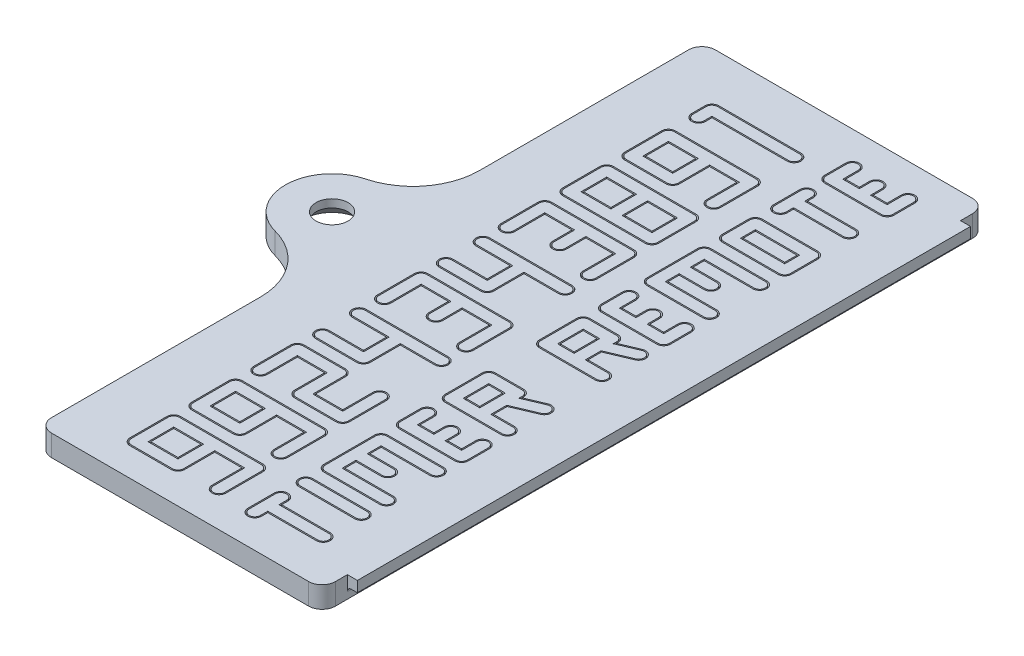
from build123d import *

# Parameters (mm, degrees)
DOOR_PLATE_1_6_SCREW_EAR_R5_R3_5_DEPTH        = 1.6
HOOK_FLANGE_0_75_X_0_8_INNER_FACE_P_2_W       = 0.9
HOOK_FLANGE_0_75_X_0_8_INNER_FACE_P_2_H       = 46
HOOK_FLANGE_0_75_X_0_8_INNER_FACE_PLANE_DEPTH = 0.8
SCREW_HOLE_2_4_FREE_SKETCH_R                  = 1.2
SCREW_HOLE_2_4_FREE_DEPTH                     = 73.114700304
SCREW_CSK_90DEG_M2_SIZE                       = 1
DOOR_CORNERS_R1_PRINT_R                       = 1
HOOK_FLANGE_ROOT_FILLET_R0_3_R                = 0.3
DOOR_TEXT_SLITS_9924343891_TIMER_REMOT_DEPTH  = 0.4
DOOR_TEXT_COUNTER_SLITS_SKETCH_W              = 2.24
DOOR_TEXT_COUNTER_SLITS_SKETCH_H              = 1.92
DOOR_TEXT_COUNTER_SLITS_SKETCH_W_2            = 2.04
DOOR_TEXT_COUNTER_SLITS_SKETCH_H_2            = 1.72
DOOR_TEXT_COUNTER_SLITS_SKETCH_W_3            = 1.24
DOOR_TEXT_COUNTER_SLITS_SKETCH_W_4            = 1.04
DOOR_TEXT_COUNTER_SLITS_SKETCH_W_5            = 3.32
DOOR_TEXT_COUNTER_SLITS_SKETCH_H_3            = 1.12
DOOR_TEXT_COUNTER_SLITS_SKETCH_W_6            = 3.12
DOOR_TEXT_COUNTER_SLITS_SKETCH_H_4            = 0.92
DOOR_TEXT_COUNTER_SLITS_DEPTH                 = 0.4


with BuildPart() as part:
    # Door Plate 1.6 + screw ear (R5 / R3.5) Sketch → Door Plate 1.6 + screw ear (R5 / R3.5) (new body)
    with BuildSketch(Plane(origin=(0, 0, 0), x_dir=(1, 0, 0), z_dir=(0, 1, 0))):
        with BuildLine():
            Line((9.35, 15.1), (30.65, 15.1))
            Line((30.65, 15.1), (30.65, 64.9))
            Line((30.65, 64.9), (9.35, 64.9))
            Line((9.35, 64.9), (9.35, 48.223594105))
            ThreePointArc((9.35, 48.223594105), (8.307494751, 45.167741475), (5.614705882, 43.386185808))
            ThreePointArc((5.614705882, 43.386185808), (3, 40), (5.614705882, 36.613814192))
            ThreePointArc((5.614705882, 36.613814192), (8.307494751, 34.832258525), (9.35, 31.776405895))
            Line((9.35, 31.776405895), (9.35, 15.1))
        make_face()
    extrude(amount=DOOR_PLATE_1_6_SCREW_EAR_R5_R3_5_DEPTH)

    # Hook Flange 0.75 x 0.8 _inner-face p 2 → Hook Flange 0.75 x 0.8 _inner-face plane (add)
    with BuildSketch(Plane(origin=(0, 0.8, 0), x_dir=(1, 0, 0), z_dir=(0, 1, 0))):
        with Locations((30.95, 40)):
            Rectangle(HOOK_FLANGE_0_75_X_0_8_INNER_FACE_P_2_W, HOOK_FLANGE_0_75_X_0_8_INNER_FACE_P_2_H)
    extrude(amount=HOOK_FLANGE_0_75_X_0_8_INNER_FACE_PLANE_DEPTH)

    # Screw Hole 2.4 (free) Sketch → Screw Hole 2.4 (free) (cut, through all)
    with BuildSketch(Plane(origin=(0, 0, 0), x_dir=(1, 0, 0), z_dir=(0, 1, 0))):
        with Locations((6.5, 40)):
            Circle(SCREW_HOLE_2_4_FREE_SKETCH_R)
    extrude(amount=SCREW_HOLE_2_4_FREE_DEPTH, mode=Mode.SUBTRACT)

    # Screw CSK 90deg (M2)
    screw_csk_90deg_m2_edges = [part.edges().sort_by_distance(p)[0] for p in [
        (5.3, 0, -40),
    ]]
    chamfer(screw_csk_90deg_m2_edges, length=SCREW_CSK_90DEG_M2_SIZE)

    # Door Corners R1 (print)
    door_corners_r1_print_edges = [part.edges().sort_by_distance(p)[0] for p in [
        (9.35, 0.8, -64.9),
        (30.65, 0.8, -64.9),
        (30.65, 0.8, -15.1),
        (9.35, 0.8, -15.1),
    ]]
    fillet(door_corners_r1_print_edges, radius=DOOR_CORNERS_R1_PRINT_R)

    # Hook Flange Root Fillet R0.3
    hook_flange_root_fillet_r0_3_edges = [part.edges().sort_by_distance(p)[0] for p in [
        (30.65, 0.8, -40),
    ]]
    fillet(hook_flange_root_fillet_r0_3_edges, radius=HOOK_FLANGE_ROOT_FILLET_R0_3_R)

    # Door Text Slits 9924343891 _ TIMER R 2 → Door Text Slits 9924343891 _ TIMER REMOT (cut)
    # profile 1 of 21: a face of its own
    with BuildSketch(Plane(origin=(0, 1.6, 0), x_dir=(1, 0, 0), z_dir=(0, 1, 0))):
        with BuildLine():
            Line((17.2, 17.22), (14.12, 17.22))
            ThreePointArc((14.12, 17.22), (13.752304474, 17.372304474), (13.6, 17.74))
            Line((13.6, 17.74), (13.6, 20.5))
            ThreePointArc((13.6, 20.5), (13.752304474, 20.867695526), (14.12, 21.02))
            Line((14.12, 21.02), (20.28, 21.02))
            ThreePointArc((20.28, 21.02), (20.647695526, 20.867695526), (20.8, 20.5))
            Line((20.8, 20.5), (20.8, 17.74))
            ThreePointArc((20.8, 17.74), (20.28, 17.22), (19.76, 17.74))
            Line((19.76, 17.74), (19.76, 19.98))
            Line((19.76, 19.98), (17.72, 19.98))
            Line((17.72, 19.98), (17.72, 17.74))
            ThreePointArc((17.72, 17.74), (17.567695526, 17.372304474), (17.2, 17.22))
        make_face()
        with BuildLine():
            Line((13.7, 20.5), (13.7, 17.74))
            ThreePointArc((13.7, 17.74), (13.823015152, 17.443015152), (14.12, 17.32))
            Line((14.12, 17.32), (17.2, 17.32))
            ThreePointArc((17.2, 17.32), (17.496984848, 17.443015152), (17.62, 17.74))
            Line((17.62, 17.74), (17.62, 20.08))
            Line((17.62, 20.08), (19.86, 20.08))
            Line((19.86, 20.08), (19.86, 17.74))
            ThreePointArc((19.86, 17.74), (20.28, 17.32), (20.7, 17.74))
            Line((20.7, 17.74), (20.7, 20.5))
            ThreePointArc((20.7, 20.5), (20.576984848, 20.796984848), (20.28, 20.92))
            Line((20.28, 20.92), (14.12, 20.92))
            ThreePointArc((14.12, 20.92), (13.823015152, 20.796984848), (13.7, 20.5))
        make_face(mode=Mode.SUBTRACT)
    # profile 2 of 21: a face of its own
    with BuildSketch(Plane(origin=(0, 1.6, 0), x_dir=(1, 0, 0), z_dir=(0, 1, 0))):
        with BuildLine():
            Line((17.2, 21.86), (14.12, 21.86))
            ThreePointArc((14.12, 21.86), (13.752304474, 22.012304474), (13.6, 22.38))
            Line((13.6, 22.38), (13.6, 25.14))
            ThreePointArc((13.6, 25.14), (13.752304474, 25.507695526), (14.12, 25.66))
            Line((14.12, 25.66), (20.28, 25.66))
            ThreePointArc((20.28, 25.66), (20.647695526, 25.507695526), (20.8, 25.14))
            Line((20.8, 25.14), (20.8, 22.38))
            ThreePointArc((20.8, 22.38), (20.28, 21.86), (19.76, 22.38))
            Line((19.76, 22.38), (19.76, 24.62))
            Line((19.76, 24.62), (17.72, 24.62))
            Line((17.72, 24.62), (17.72, 22.38))
            ThreePointArc((17.72, 22.38), (17.567695526, 22.012304474), (17.2, 21.86))
        make_face()
        with BuildLine():
            Line((13.7, 25.14), (13.7, 22.38))
            ThreePointArc((13.7, 22.38), (13.823015152, 22.083015152), (14.12, 21.96))
            Line((14.12, 21.96), (17.2, 21.96))
            ThreePointArc((17.2, 21.96), (17.496984848, 22.083015152), (17.62, 22.38))
            Line((17.62, 22.38), (17.62, 24.72))
            Line((17.62, 24.72), (19.86, 24.72))
            Line((19.86, 24.72), (19.86, 22.38))
            ThreePointArc((19.86, 22.38), (20.28, 21.96), (20.7, 22.38))
            Line((20.7, 22.38), (20.7, 25.14))
            ThreePointArc((20.7, 25.14), (20.576984848, 25.436984848), (20.28, 25.56))
            Line((20.28, 25.56), (14.12, 25.56))
            ThreePointArc((14.12, 25.56), (13.823015152, 25.436984848), (13.7, 25.14))
        make_face(mode=Mode.SUBTRACT)
    # profile 3 of 21: a face of its own
    with BuildSketch(Plane(origin=(0, 1.6, 0), x_dir=(1, 0, 0), z_dir=(0, 1, 0))):
        with BuildLine():
            Line((20.8, 29.78), (20.8, 27.02))
            ThreePointArc((20.8, 27.02), (20.647695526, 26.652304474), (20.28, 26.5))
            Line((20.28, 26.5), (17.2, 26.5))
            ThreePointArc((17.2, 26.5), (16.832304474, 26.652304474), (16.68, 27.02))
            Line((16.68, 27.02), (16.68, 29.26))
            Line((16.68, 29.26), (14.64, 29.26))
            Line((14.64, 29.26), (14.64, 27.02))
            ThreePointArc((14.64, 27.02), (14.12, 26.5), (13.6, 27.02))
            Line((13.6, 27.02), (13.6, 29.78))
            ThreePointArc((13.6, 29.78), (13.752304474, 30.147695526), (14.12, 30.3))
            Line((14.12, 30.3), (17.2, 30.3))
            ThreePointArc((17.2, 30.3), (17.567695526, 30.147695526), (17.72, 29.78))
            Line((17.72, 29.78), (17.72, 27.54))
            Line((17.72, 27.54), (19.76, 27.54))
            Line((19.76, 27.54), (19.76, 29.78))
            ThreePointArc((19.76, 29.78), (20.28, 30.3), (20.8, 29.78))
        make_face()
        with BuildLine():
            Line((14.54, 29.36), (14.54, 27.02))
            ThreePointArc((14.54, 27.02), (14.12, 26.6), (13.7, 27.02))
            Line((13.7, 27.02), (13.7, 29.78))
            ThreePointArc((13.7, 29.78), (13.823015152, 30.076984848), (14.12, 30.2))
            Line((14.12, 30.2), (17.2, 30.2))
            ThreePointArc((17.2, 30.2), (17.496984848, 30.076984848), (17.62, 29.78))
            Line((17.62, 29.78), (17.62, 27.44))
            Line((17.62, 27.44), (19.86, 27.44))
            Line((19.86, 27.44), (19.86, 29.78))
            ThreePointArc((19.86, 29.78), (20.28, 30.2), (20.7, 29.78))
            Line((20.7, 29.78), (20.7, 27.02))
            ThreePointArc((20.7, 27.02), (20.576984848, 26.723015152), (20.28, 26.6))
            Line((20.28, 26.6), (17.2, 26.6))
            ThreePointArc((17.2, 26.6), (16.903015152, 26.723015152), (16.78, 27.02))
            Line((16.78, 27.02), (16.78, 29.36))
            Line((16.78, 29.36), (14.54, 29.36))
        make_face(mode=Mode.SUBTRACT)
    # profile 4 of 21: a face of its own
    with BuildSketch(Plane(origin=(0, 1.6, 0), x_dir=(1, 0, 0), z_dir=(0, 1, 0))):
        with BuildLine():
            Line((20.28, 33.9), (17.72, 33.9))
            Line((17.72, 33.9), (17.72, 31.66))
            ThreePointArc((17.72, 31.66), (17.567695526, 31.292304474), (17.2, 31.14))
            Line((17.2, 31.14), (14.12, 31.14))
            ThreePointArc((14.12, 31.14), (13.6, 31.66), (14.12, 32.18))
            Line((14.12, 32.18), (16.68, 32.18))
            Line((16.68, 32.18), (16.68, 33.9))
            Line((16.68, 33.9), (14.12, 33.9))
            ThreePointArc((14.12, 33.9), (13.6, 34.42), (14.12, 34.94))
            Line((14.12, 34.94), (20.28, 34.94))
            ThreePointArc((20.28, 34.94), (20.647695526, 34.787695526), (20.8, 34.42))
            ThreePointArc((20.8, 34.42), (20.647695526, 34.052304474), (20.28, 33.9))
        make_face()
        with BuildLine():
            Line((17.62, 31.66), (17.62, 34))
            Line((17.62, 34), (20.28, 34))
            ThreePointArc((20.28, 34), (20.576984848, 34.123015152), (20.7, 34.42))
            ThreePointArc((20.7, 34.42), (20.576984848, 34.716984848), (20.28, 34.84))
            Line((20.28, 34.84), (14.12, 34.84))
            ThreePointArc((14.12, 34.84), (13.7, 34.42), (14.12, 34))
            Line((14.12, 34), (16.78, 34))
            Line((16.78, 34), (16.78, 32.08))
            Line((16.78, 32.08), (14.12, 32.08))
            ThreePointArc((14.12, 32.08), (13.7, 31.66), (14.12, 31.24))
            Line((14.12, 31.24), (17.2, 31.24))
            ThreePointArc((17.2, 31.24), (17.496984848, 31.363015152), (17.62, 31.66))
        make_face(mode=Mode.SUBTRACT)
    # profile 5 of 21: a face of its own
    with BuildSketch(Plane(origin=(0, 1.6, 0), x_dir=(1, 0, 0), z_dir=(0, 1, 0))):
        with BuildLine():
            Line((19.76, 36.3), (19.76, 38.54))
            Line((19.76, 38.54), (17.72, 38.54))
            Line((17.72, 38.54), (17.72, 37.1))
            ThreePointArc((17.72, 37.1), (17.2, 36.58), (16.68, 37.1))
            Line((16.68, 37.1), (16.68, 38.54))
            Line((16.68, 38.54), (14.64, 38.54))
            Line((14.64, 38.54), (14.64, 36.3))
            ThreePointArc((14.64, 36.3), (14.12, 35.78), (13.6, 36.3))
            Line((13.6, 36.3), (13.6, 39.06))
            ThreePointArc((13.6, 39.06), (13.752304474, 39.427695526), (14.12, 39.58))
            Line((14.12, 39.58), (20.28, 39.58))
            ThreePointArc((20.28, 39.58), (20.647695526, 39.427695526), (20.8, 39.06))
            Line((20.8, 39.06), (20.8, 36.3))
            ThreePointArc((20.8, 36.3), (20.28, 35.78), (19.76, 36.3))
        make_face()
        with BuildLine():
            Line((13.7, 36.3), (13.7, 39.06))
            ThreePointArc((13.7, 39.06), (13.823015152, 39.356984848), (14.12, 39.48))
            Line((14.12, 39.48), (20.28, 39.48))
            ThreePointArc((20.28, 39.48), (20.576984848, 39.356984848), (20.7, 39.06))
            Line((20.7, 39.06), (20.7, 36.3))
            ThreePointArc((20.7, 36.3), (20.28, 35.88), (19.86, 36.3))
            Line((19.86, 36.3), (19.86, 38.64))
            Line((19.86, 38.64), (17.62, 38.64))
            Line((17.62, 38.64), (17.62, 37.1))
            ThreePointArc((17.62, 37.1), (17.2, 36.68), (16.78, 37.1))
            Line((16.78, 37.1), (16.78, 38.64))
            Line((16.78, 38.64), (14.54, 38.64))
            Line((14.54, 38.64), (14.54, 36.3))
            ThreePointArc((14.54, 36.3), (14.12, 35.88), (13.7, 36.3))
        make_face(mode=Mode.SUBTRACT)
    # profile 6 of 21: a face of its own
    with BuildSketch(Plane(origin=(0, 1.6, 0), x_dir=(1, 0, 0), z_dir=(0, 1, 0))):
        with BuildLine():
            Line((20.28, 43.18), (17.72, 43.18))
            Line((17.72, 43.18), (17.72, 40.94))
            ThreePointArc((17.72, 40.94), (17.567695526, 40.572304474), (17.2, 40.42))
            Line((17.2, 40.42), (14.12, 40.42))
            ThreePointArc((14.12, 40.42), (13.6, 40.94), (14.12, 41.46))
            Line((14.12, 41.46), (16.68, 41.46))
            Line((16.68, 41.46), (16.68, 43.18))
            Line((16.68, 43.18), (14.12, 43.18))
            ThreePointArc((14.12, 43.18), (13.6, 43.7), (14.12, 44.22))
            Line((14.12, 44.22), (20.28, 44.22))
            ThreePointArc((20.28, 44.22), (20.647695526, 44.067695526), (20.8, 43.7))
            ThreePointArc((20.8, 43.7), (20.647695526, 43.332304474), (20.28, 43.18))
        make_face()
        with BuildLine():
            Line((17.62, 40.94), (17.62, 43.28))
            Line((17.62, 43.28), (20.28, 43.28))
            ThreePointArc((20.28, 43.28), (20.576984848, 43.403015152), (20.7, 43.7))
            ThreePointArc((20.7, 43.7), (20.576984848, 43.996984848), (20.28, 44.12))
            Line((20.28, 44.12), (14.12, 44.12))
            ThreePointArc((14.12, 44.12), (13.7, 43.7), (14.12, 43.28))
            Line((14.12, 43.28), (16.78, 43.28))
            Line((16.78, 43.28), (16.78, 41.36))
            Line((16.78, 41.36), (14.12, 41.36))
            ThreePointArc((14.12, 41.36), (13.7, 40.94), (14.12, 40.52))
            Line((14.12, 40.52), (17.2, 40.52))
            ThreePointArc((17.2, 40.52), (17.496984848, 40.643015152), (17.62, 40.94))
        make_face(mode=Mode.SUBTRACT)
    # profile 7 of 21: a face of its own
    with BuildSketch(Plane(origin=(0, 1.6, 0), x_dir=(1, 0, 0), z_dir=(0, 1, 0))):
        with BuildLine():
            Line((19.76, 45.58), (19.76, 47.82))
            Line((19.76, 47.82), (17.72, 47.82))
            Line((17.72, 47.82), (17.72, 46.38))
            ThreePointArc((17.72, 46.38), (17.2, 45.86), (16.68, 46.38))
            Line((16.68, 46.38), (16.68, 47.82))
            Line((16.68, 47.82), (14.64, 47.82))
            Line((14.64, 47.82), (14.64, 45.58))
            ThreePointArc((14.64, 45.58), (14.12, 45.06), (13.6, 45.58))
            Line((13.6, 45.58), (13.6, 48.34))
            ThreePointArc((13.6, 48.34), (13.752304474, 48.707695526), (14.12, 48.86))
            Line((14.12, 48.86), (20.28, 48.86))
            ThreePointArc((20.28, 48.86), (20.647695526, 48.707695526), (20.8, 48.34))
            Line((20.8, 48.34), (20.8, 45.58))
            ThreePointArc((20.8, 45.58), (20.28, 45.06), (19.76, 45.58))
        make_face()
        with BuildLine():
            Line((13.7, 45.58), (13.7, 48.34))
            ThreePointArc((13.7, 48.34), (13.823015152, 48.636984848), (14.12, 48.76))
            Line((14.12, 48.76), (20.28, 48.76))
            ThreePointArc((20.28, 48.76), (20.576984848, 48.636984848), (20.7, 48.34))
            Line((20.7, 48.34), (20.7, 45.58))
            ThreePointArc((20.7, 45.58), (20.28, 45.16), (19.86, 45.58))
            Line((19.86, 45.58), (19.86, 47.92))
            Line((19.86, 47.92), (17.62, 47.92))
            Line((17.62, 47.92), (17.62, 46.38))
            ThreePointArc((17.62, 46.38), (17.2, 45.96), (16.78, 46.38))
            Line((16.78, 46.38), (16.78, 47.92))
            Line((16.78, 47.92), (14.54, 47.92))
            Line((14.54, 47.92), (14.54, 45.58))
            ThreePointArc((14.54, 45.58), (14.12, 45.16), (13.7, 45.58))
        make_face(mode=Mode.SUBTRACT)
    # profile 8 of 21: a face of its own
    with BuildSketch(Plane(origin=(0, 1.6, 0), x_dir=(1, 0, 0), z_dir=(0, 1, 0))):
        with BuildLine():
            Line((20.8, 52.98), (20.8, 50.22))
            ThreePointArc((20.8, 50.22), (20.647695526, 49.852304474), (20.28, 49.7))
            Line((20.28, 49.7), (14.12, 49.7))
            ThreePointArc((14.12, 49.7), (13.752304474, 49.852304474), (13.6, 50.22))
            Line((13.6, 50.22), (13.6, 52.98))
            ThreePointArc((13.6, 52.98), (13.752304474, 53.347695526), (14.12, 53.5))
            Line((14.12, 53.5), (20.28, 53.5))
            ThreePointArc((20.28, 53.5), (20.647695526, 53.347695526), (20.8, 52.98))
        make_face()
        with BuildLine():
            Line((20.7, 50.22), (20.7, 52.98))
            ThreePointArc((20.7, 52.98), (20.576984848, 53.276984848), (20.28, 53.4))
            Line((20.28, 53.4), (14.12, 53.4))
            ThreePointArc((14.12, 53.4), (13.823015152, 53.276984848), (13.7, 52.98))
            Line((13.7, 52.98), (13.7, 50.22))
            ThreePointArc((13.7, 50.22), (13.823015152, 49.923015152), (14.12, 49.8))
            Line((14.12, 49.8), (20.28, 49.8))
            ThreePointArc((20.28, 49.8), (20.576984848, 49.923015152), (20.7, 50.22))
        make_face(mode=Mode.SUBTRACT)
    # profile 9 of 21: a face of its own
    with BuildSketch(Plane(origin=(0, 1.6, 0), x_dir=(1, 0, 0), z_dir=(0, 1, 0))):
        with BuildLine():
            Line((17.2, 54.34), (14.12, 54.34))
            ThreePointArc((14.12, 54.34), (13.752304474, 54.492304474), (13.6, 54.86))
            Line((13.6, 54.86), (13.6, 57.62))
            ThreePointArc((13.6, 57.62), (13.752304474, 57.987695526), (14.12, 58.14))
            Line((14.12, 58.14), (20.28, 58.14))
            ThreePointArc((20.28, 58.14), (20.647695526, 57.987695526), (20.8, 57.62))
            Line((20.8, 57.62), (20.8, 54.86))
            ThreePointArc((20.8, 54.86), (20.28, 54.34), (19.76, 54.86))
            Line((19.76, 54.86), (19.76, 57.1))
            Line((19.76, 57.1), (17.72, 57.1))
            Line((17.72, 57.1), (17.72, 54.86))
            ThreePointArc((17.72, 54.86), (17.567695526, 54.492304474), (17.2, 54.34))
        make_face()
        with BuildLine():
            Line((13.7, 57.62), (13.7, 54.86))
            ThreePointArc((13.7, 54.86), (13.823015152, 54.563015152), (14.12, 54.44))
            Line((14.12, 54.44), (17.2, 54.44))
            ThreePointArc((17.2, 54.44), (17.496984848, 54.563015152), (17.62, 54.86))
            Line((17.62, 54.86), (17.62, 57.2))
            Line((17.62, 57.2), (19.86, 57.2))
            Line((19.86, 57.2), (19.86, 54.86))
            ThreePointArc((19.86, 54.86), (20.28, 54.44), (20.7, 54.86))
            Line((20.7, 54.86), (20.7, 57.62))
            ThreePointArc((20.7, 57.62), (20.576984848, 57.916984848), (20.28, 58.04))
            Line((20.28, 58.04), (14.12, 58.04))
            ThreePointArc((14.12, 58.04), (13.823015152, 57.916984848), (13.7, 57.62))
        make_face(mode=Mode.SUBTRACT)
    # profile 10 of 21: a face of its own
    with BuildSketch(Plane(origin=(0, 1.6, 0), x_dir=(1, 0, 0), z_dir=(0, 1, 0))):
        with BuildLine():
            Line((20.28, 60.36), (14.64, 60.36))
            Line((14.64, 60.36), (14.64, 59.88))
            ThreePointArc((14.64, 59.88), (14.12, 59.36), (13.6, 59.88))
            Line((13.6, 59.88), (13.6, 60.88))
            ThreePointArc((13.6, 60.88), (13.752304474, 61.247695526), (14.12, 61.4))
            Line((14.12, 61.4), (20.28, 61.4))
            ThreePointArc((20.28, 61.4), (20.647695526, 61.247695526), (20.8, 60.88))
            ThreePointArc((20.8, 60.88), (20.647695526, 60.512304474), (20.28, 60.36))
        make_face()
        with BuildLine():
            Line((14.54, 60.46), (14.54, 59.88))
            ThreePointArc((14.54, 59.88), (14.12, 59.46), (13.7, 59.88))
            Line((13.7, 59.88), (13.7, 60.88))
            ThreePointArc((13.7, 60.88), (13.823015152, 61.176984848), (14.12, 61.3))
            Line((14.12, 61.3), (20.28, 61.3))
            ThreePointArc((20.28, 61.3), (20.576984848, 61.176984848), (20.7, 60.88))
            ThreePointArc((20.7, 60.88), (20.576984848, 60.583015152), (20.28, 60.46))
            Line((20.28, 60.46), (14.54, 60.46))
        make_face(mode=Mode.SUBTRACT)
    # profile 11 of 21: a face of its own
    with BuildSketch(Plane(origin=(0, 1.6, 0), x_dir=(1, 0, 0), z_dir=(0, 1, 0))):
        with BuildLine():
            Line((23.64, 19.08), (27.28, 19.08))
            ThreePointArc((27.28, 19.08), (27.647695526, 18.927695526), (27.8, 18.56))
            ThreePointArc((27.8, 18.56), (27.647695526, 18.192304474), (27.28, 18.04))
            Line((27.28, 18.04), (23.64, 18.04))
            Line((23.64, 18.04), (23.64, 17.58))
            ThreePointArc((23.64, 17.58), (23.12, 17.06), (22.6, 17.58))
            Line((22.6, 17.58), (22.6, 19.54))
            ThreePointArc((22.6, 19.54), (23.12, 20.06), (23.64, 19.54))
            Line((23.64, 19.54), (23.64, 19.08))
        make_face()
        with BuildLine():
            Line((22.7, 17.58), (22.7, 19.54))
            ThreePointArc((22.7, 19.54), (23.12, 19.96), (23.54, 19.54))
            Line((23.54, 19.54), (23.54, 18.98))
            Line((23.54, 18.98), (27.28, 18.98))
            ThreePointArc((27.28, 18.98), (27.576984848, 18.856984848), (27.7, 18.56))
            ThreePointArc((27.7, 18.56), (27.576984848, 18.263015152), (27.28, 18.14))
            Line((27.28, 18.14), (23.54, 18.14))
            Line((23.54, 18.14), (23.54, 17.58))
            ThreePointArc((23.54, 17.58), (23.12, 17.16), (22.7, 17.58))
        make_face(mode=Mode.SUBTRACT)
    # profile 12 of 21: a face of its own
    with BuildSketch(Plane(origin=(0, 1.6, 0), x_dir=(1, 0, 0), z_dir=(0, 1, 0))):
        with BuildLine():
            Line((27.28, 20.9), (23.12, 20.9))
            ThreePointArc((23.12, 20.9), (22.6, 21.42), (23.12, 21.94))
            Line((23.12, 21.94), (27.28, 21.94))
            ThreePointArc((27.28, 21.94), (27.647695526, 21.787695526), (27.8, 21.42))
            ThreePointArc((27.8, 21.42), (27.647695526, 21.052304474), (27.28, 20.9))
        make_face()
        with BuildLine():
            Line((27.28, 21), (23.12, 21))
            ThreePointArc((23.12, 21), (22.7, 21.42), (23.12, 21.84))
            Line((23.12, 21.84), (27.28, 21.84))
            ThreePointArc((27.28, 21.84), (27.576984848, 21.716984848), (27.7, 21.42))
            ThreePointArc((27.7, 21.42), (27.576984848, 21.123015152), (27.28, 21))
        make_face(mode=Mode.SUBTRACT)
    # profile 13 of 21: a face of its own
    with BuildSketch(Plane(origin=(0, 1.6, 0), x_dir=(1, 0, 0), z_dir=(0, 1, 0))):
        with BuildLine():
            Line((27.28, 26.54), (23.64, 26.54))
            Line((23.64, 26.54), (23.64, 25.7))
            Line((23.64, 25.7), (25.5, 25.7))
            ThreePointArc((25.5, 25.7), (25.867695526, 25.547695526), (26.02, 25.18))
            ThreePointArc((26.02, 25.18), (25.867695526, 24.812304474), (25.5, 24.66))
            Line((25.5, 24.66), (23.64, 24.66))
            Line((23.64, 24.66), (23.64, 23.82))
            Line((23.64, 23.82), (27.28, 23.82))
            ThreePointArc((27.28, 23.82), (27.647695526, 23.667695526), (27.8, 23.3))
            ThreePointArc((27.8, 23.3), (27.647695526, 22.932304474), (27.28, 22.78))
            Line((27.28, 22.78), (23.12, 22.78))
            ThreePointArc((23.12, 22.78), (22.752304474, 22.932304474), (22.6, 23.3))
            Line((22.6, 23.3), (22.6, 27.06))
            ThreePointArc((22.6, 27.06), (22.752304474, 27.427695526), (23.12, 27.58))
            Line((23.12, 27.58), (27.28, 27.58))
            ThreePointArc((27.28, 27.58), (27.647695526, 27.427695526), (27.8, 27.06))
            ThreePointArc((27.8, 27.06), (27.647695526, 26.692304474), (27.28, 26.54))
        make_face()
        with BuildLine():
            Line((27.28, 22.88), (23.12, 22.88))
            ThreePointArc((23.12, 22.88), (22.823015152, 23.003015152), (22.7, 23.3))
            Line((22.7, 23.3), (22.7, 27.06))
            ThreePointArc((22.7, 27.06), (22.823015152, 27.356984848), (23.12, 27.48))
            Line((23.12, 27.48), (27.28, 27.48))
            ThreePointArc((27.28, 27.48), (27.576984848, 27.356984848), (27.7, 27.06))
            ThreePointArc((27.7, 27.06), (27.576984848, 26.763015152), (27.28, 26.64))
            Line((27.28, 26.64), (23.54, 26.64))
            Line((23.54, 26.64), (23.54, 25.6))
            Line((23.54, 25.6), (25.5, 25.6))
            ThreePointArc((25.5, 25.6), (25.796984848, 25.476984848), (25.92, 25.18))
            ThreePointArc((25.92, 25.18), (25.796984848, 24.883015152), (25.5, 24.76))
            Line((25.5, 24.76), (23.54, 24.76))
            Line((23.54, 24.76), (23.54, 23.72))
            Line((23.54, 23.72), (27.28, 23.72))
            ThreePointArc((27.28, 23.72), (27.576984848, 23.596984848), (27.7, 23.3))
            ThreePointArc((27.7, 23.3), (27.576984848, 23.003015152), (27.28, 22.88))
        make_face(mode=Mode.SUBTRACT)
    # profile 14 of 21: a face of its own
    with BuildSketch(Plane(origin=(0, 1.6, 0), x_dir=(1, 0, 0), z_dir=(0, 1, 0))):
        with BuildLine():
            Line((26.76, 29.46), (26.76, 30.5))
            ThreePointArc((26.76, 30.5), (27.28, 31.02), (27.8, 30.5))
            Line((27.8, 30.5), (27.8, 28.94))
            ThreePointArc((27.8, 28.94), (27.647695526, 28.572304474), (27.28, 28.42))
            Line((27.28, 28.42), (23.12, 28.42))
            ThreePointArc((23.12, 28.42), (22.752304474, 28.572304474), (22.6, 28.94))
            Line((22.6, 28.94), (22.6, 30.5))
            ThreePointArc((22.6, 30.5), (23.12, 31.02), (23.64, 30.5))
            Line((23.64, 30.5), (23.64, 29.46))
            Line((23.64, 29.46), (24.68, 29.46))
            Line((24.68, 29.46), (24.68, 30.2))
            ThreePointArc((24.68, 30.2), (25.2, 30.72), (25.72, 30.2))
            Line((25.72, 30.2), (25.72, 29.46))
            Line((25.72, 29.46), (26.76, 29.46))
        make_face()
        with BuildLine():
            Line((23.12, 28.52), (27.28, 28.52))
            ThreePointArc((27.28, 28.52), (27.576984848, 28.643015152), (27.7, 28.94))
            Line((27.7, 28.94), (27.7, 30.5))
            ThreePointArc((27.7, 30.5), (27.28, 30.92), (26.86, 30.5))
            Line((26.86, 30.5), (26.86, 29.36))
            Line((26.86, 29.36), (25.62, 29.36))
            Line((25.62, 29.36), (25.62, 30.2))
            ThreePointArc((25.62, 30.2), (25.2, 30.62), (24.78, 30.2))
            Line((24.78, 30.2), (24.78, 29.36))
            Line((24.78, 29.36), (23.54, 29.36))
            Line((23.54, 29.36), (23.54, 30.5))
            ThreePointArc((23.54, 30.5), (23.12, 30.92), (22.7, 30.5))
            Line((22.7, 30.5), (22.7, 28.94))
            ThreePointArc((22.7, 28.94), (22.823015152, 28.643015152), (23.12, 28.52))
        make_face(mode=Mode.SUBTRACT)
    # profile 15 of 21: a face of its own
    with BuildSketch(Plane(origin=(0, 1.6, 0), x_dir=(1, 0, 0), z_dir=(0, 1, 0))):
        with BuildLine():
            Line((25.72, 35.14), (25.72, 35.044623769))
            Line((25.72, 35.044623769), (27.077387205, 35.618902971))
            ThreePointArc((27.077387205, 35.618902971), (27.567264118, 35.573450489), (27.8, 35.14))
            ThreePointArc((27.8, 35.14), (27.713450489, 34.852735882), (27.482612795, 34.661097029))
            Line((27.482612795, 34.661097029), (25.72, 33.915376231))
            Line((25.72, 33.915376231), (25.72, 32.9))
            Line((25.72, 32.9), (27.28, 32.9))
            ThreePointArc((27.28, 32.9), (27.647695526, 32.747695526), (27.8, 32.38))
            ThreePointArc((27.8, 32.38), (27.647695526, 32.012304474), (27.28, 31.86))
            Line((27.28, 31.86), (23.12, 31.86))
            ThreePointArc((23.12, 31.86), (22.752304474, 32.012304474), (22.6, 32.38))
            Line((22.6, 32.38), (22.6, 35.14))
            ThreePointArc((22.6, 35.14), (22.752304474, 35.507695526), (23.12, 35.66))
            Line((23.12, 35.66), (25.2, 35.66))
            ThreePointArc((25.2, 35.66), (25.567695526, 35.507695526), (25.72, 35.14))
        make_face()
        with BuildLine():
            Line((27.28, 31.96), (23.12, 31.96))
            ThreePointArc((23.12, 31.96), (22.823015152, 32.083015152), (22.7, 32.38))
            Line((22.7, 32.38), (22.7, 35.14))
            ThreePointArc((22.7, 35.14), (22.823015152, 35.436984848), (23.12, 35.56))
            Line((23.12, 35.56), (25.2, 35.56))
            ThreePointArc((25.2, 35.56), (25.496984848, 35.436984848), (25.62, 35.14))
            Line((25.62, 35.14), (25.62, 34.893734582))
            Line((25.62, 34.893734582), (27.116351204, 35.526806245))
            ThreePointArc((27.116351204, 35.526806245), (27.512021018, 35.490094626), (27.7, 35.14))
            ThreePointArc((27.7, 35.14), (27.630094626, 34.907978982), (27.443648796, 34.753193755))
            Line((27.443648796, 34.753193755), (25.62, 33.981650033))
            Line((25.62, 33.981650033), (25.62, 32.8))
            Line((25.62, 32.8), (27.28, 32.8))
            ThreePointArc((27.28, 32.8), (27.576984848, 32.676984848), (27.7, 32.38))
            ThreePointArc((27.7, 32.38), (27.576984848, 32.083015152), (27.28, 31.96))
        make_face(mode=Mode.SUBTRACT)
    # profile 16 of 21: a face of its own
    with BuildSketch(Plane(origin=(0, 1.6, 0), x_dir=(1, 0, 0), z_dir=(0, 1, 0))):
        with BuildLine():
            Line((25.72, 42.22), (25.72, 42.124623769))
            Line((25.72, 42.124623769), (27.077387205, 42.698902971))
            ThreePointArc((27.077387205, 42.698902971), (27.567264118, 42.653450489), (27.8, 42.22))
            ThreePointArc((27.8, 42.22), (27.713450489, 41.932735882), (27.482612795, 41.741097029))
            Line((27.482612795, 41.741097029), (25.72, 40.995376231))
            Line((25.72, 40.995376231), (25.72, 39.98))
            Line((25.72, 39.98), (27.28, 39.98))
            ThreePointArc((27.28, 39.98), (27.647695526, 39.827695526), (27.8, 39.46))
            ThreePointArc((27.8, 39.46), (27.647695526, 39.092304474), (27.28, 38.94))
            Line((27.28, 38.94), (23.12, 38.94))
            ThreePointArc((23.12, 38.94), (22.752304474, 39.092304474), (22.6, 39.46))
            Line((22.6, 39.46), (22.6, 42.22))
            ThreePointArc((22.6, 42.22), (22.752304474, 42.587695526), (23.12, 42.74))
            Line((23.12, 42.74), (25.2, 42.74))
            ThreePointArc((25.2, 42.74), (25.567695526, 42.587695526), (25.72, 42.22))
        make_face()
        with BuildLine():
            Line((27.28, 39.04), (23.12, 39.04))
            ThreePointArc((23.12, 39.04), (22.823015152, 39.163015152), (22.7, 39.46))
            Line((22.7, 39.46), (22.7, 42.22))
            ThreePointArc((22.7, 42.22), (22.823015152, 42.516984848), (23.12, 42.64))
            Line((23.12, 42.64), (25.2, 42.64))
            ThreePointArc((25.2, 42.64), (25.496984848, 42.516984848), (25.62, 42.22))
            Line((25.62, 42.22), (25.62, 41.973734582))
            Line((25.62, 41.973734582), (27.116351204, 42.606806245))
            ThreePointArc((27.116351204, 42.606806245), (27.512021018, 42.570094626), (27.7, 42.22))
            ThreePointArc((27.7, 42.22), (27.630094626, 41.987978982), (27.443648796, 41.833193755))
            Line((27.443648796, 41.833193755), (25.62, 41.061650033))
            Line((25.62, 41.061650033), (25.62, 39.88))
            Line((25.62, 39.88), (27.28, 39.88))
            ThreePointArc((27.28, 39.88), (27.576984848, 39.756984848), (27.7, 39.46))
            ThreePointArc((27.7, 39.46), (27.576984848, 39.163015152), (27.28, 39.04))
        make_face(mode=Mode.SUBTRACT)
    # profile 17 of 21: a face of its own
    with BuildSketch(Plane(origin=(0, 1.6, 0), x_dir=(1, 0, 0), z_dir=(0, 1, 0))):
        with BuildLine():
            Line((26.76, 44.62), (26.76, 45.66))
            ThreePointArc((26.76, 45.66), (27.28, 46.18), (27.8, 45.66))
            Line((27.8, 45.66), (27.8, 44.1))
            ThreePointArc((27.8, 44.1), (27.647695526, 43.732304474), (27.28, 43.58))
            Line((27.28, 43.58), (23.12, 43.58))
            ThreePointArc((23.12, 43.58), (22.752304474, 43.732304474), (22.6, 44.1))
            Line((22.6, 44.1), (22.6, 45.66))
            ThreePointArc((22.6, 45.66), (23.12, 46.18), (23.64, 45.66))
            Line((23.64, 45.66), (23.64, 44.62))
            Line((23.64, 44.62), (24.68, 44.62))
            Line((24.68, 44.62), (24.68, 45.36))
            ThreePointArc((24.68, 45.36), (25.2, 45.88), (25.72, 45.36))
            Line((25.72, 45.36), (25.72, 44.62))
            Line((25.72, 44.62), (26.76, 44.62))
        make_face()
        with BuildLine():
            Line((23.12, 43.68), (27.28, 43.68))
            ThreePointArc((27.28, 43.68), (27.576984848, 43.803015152), (27.7, 44.1))
            Line((27.7, 44.1), (27.7, 45.66))
            ThreePointArc((27.7, 45.66), (27.28, 46.08), (26.86, 45.66))
            Line((26.86, 45.66), (26.86, 44.52))
            Line((26.86, 44.52), (25.62, 44.52))
            Line((25.62, 44.52), (25.62, 45.36))
            ThreePointArc((25.62, 45.36), (25.2, 45.78), (24.78, 45.36))
            Line((24.78, 45.36), (24.78, 44.52))
            Line((24.78, 44.52), (23.54, 44.52))
            Line((23.54, 44.52), (23.54, 45.66))
            ThreePointArc((23.54, 45.66), (23.12, 46.08), (22.7, 45.66))
            Line((22.7, 45.66), (22.7, 44.1))
            ThreePointArc((22.7, 44.1), (22.823015152, 43.803015152), (23.12, 43.68))
        make_face(mode=Mode.SUBTRACT)
    # profile 18 of 21: a face of its own
    with BuildSketch(Plane(origin=(0, 1.6, 0), x_dir=(1, 0, 0), z_dir=(0, 1, 0))):
        with BuildLine():
            Line((27.28, 50.78), (23.64, 50.78))
            Line((23.64, 50.78), (23.64, 49.94))
            Line((23.64, 49.94), (25.5, 49.94))
            ThreePointArc((25.5, 49.94), (25.867695526, 49.787695526), (26.02, 49.42))
            ThreePointArc((26.02, 49.42), (25.867695526, 49.052304474), (25.5, 48.9))
            Line((25.5, 48.9), (23.64, 48.9))
            Line((23.64, 48.9), (23.64, 48.06))
            Line((23.64, 48.06), (27.28, 48.06))
            ThreePointArc((27.28, 48.06), (27.647695526, 47.907695526), (27.8, 47.54))
            ThreePointArc((27.8, 47.54), (27.647695526, 47.172304474), (27.28, 47.02))
            Line((27.28, 47.02), (23.12, 47.02))
            ThreePointArc((23.12, 47.02), (22.752304474, 47.172304474), (22.6, 47.54))
            Line((22.6, 47.54), (22.6, 51.3))
            ThreePointArc((22.6, 51.3), (22.752304474, 51.667695526), (23.12, 51.82))
            Line((23.12, 51.82), (27.28, 51.82))
            ThreePointArc((27.28, 51.82), (27.647695526, 51.667695526), (27.8, 51.3))
            ThreePointArc((27.8, 51.3), (27.647695526, 50.932304474), (27.28, 50.78))
        make_face()
        with BuildLine():
            Line((27.28, 47.12), (23.12, 47.12))
            ThreePointArc((23.12, 47.12), (22.823015152, 47.243015152), (22.7, 47.54))
            Line((22.7, 47.54), (22.7, 51.3))
            ThreePointArc((22.7, 51.3), (22.823015152, 51.596984848), (23.12, 51.72))
            Line((23.12, 51.72), (27.28, 51.72))
            ThreePointArc((27.28, 51.72), (27.576984848, 51.596984848), (27.7, 51.3))
            ThreePointArc((27.7, 51.3), (27.576984848, 51.003015152), (27.28, 50.88))
            Line((27.28, 50.88), (23.54, 50.88))
            Line((23.54, 50.88), (23.54, 49.84))
            Line((23.54, 49.84), (25.5, 49.84))
            ThreePointArc((25.5, 49.84), (25.796984848, 49.716984848), (25.92, 49.42))
            ThreePointArc((25.92, 49.42), (25.796984848, 49.123015152), (25.5, 49))
            Line((25.5, 49), (23.54, 49))
            Line((23.54, 49), (23.54, 47.96))
            Line((23.54, 47.96), (27.28, 47.96))
            ThreePointArc((27.28, 47.96), (27.576984848, 47.836984848), (27.7, 47.54))
            ThreePointArc((27.7, 47.54), (27.576984848, 47.243015152), (27.28, 47.12))
        make_face(mode=Mode.SUBTRACT)
    # profile 19 of 21: a face of its own
    with BuildSketch(Plane(origin=(0, 1.6, 0), x_dir=(1, 0, 0), z_dir=(0, 1, 0))):
        with BuildLine():
            Line((27.8, 55.14), (27.8, 53.18))
            ThreePointArc((27.8, 53.18), (27.647695526, 52.812304474), (27.28, 52.66))
            Line((27.28, 52.66), (23.12, 52.66))
            ThreePointArc((23.12, 52.66), (22.752304474, 52.812304474), (22.6, 53.18))
            Line((22.6, 53.18), (22.6, 55.14))
            ThreePointArc((22.6, 55.14), (22.752304474, 55.507695526), (23.12, 55.66))
            Line((23.12, 55.66), (27.28, 55.66))
            ThreePointArc((27.28, 55.66), (27.647695526, 55.507695526), (27.8, 55.14))
        make_face()
        with BuildLine():
            Line((27.7, 53.18), (27.7, 55.14))
            ThreePointArc((27.7, 55.14), (27.576984848, 55.436984848), (27.28, 55.56))
            Line((27.28, 55.56), (23.12, 55.56))
            ThreePointArc((23.12, 55.56), (22.823015152, 55.436984848), (22.7, 55.14))
            Line((22.7, 55.14), (22.7, 53.18))
            ThreePointArc((22.7, 53.18), (22.823015152, 52.883015152), (23.12, 52.76))
            Line((23.12, 52.76), (27.28, 52.76))
            ThreePointArc((27.28, 52.76), (27.576984848, 52.883015152), (27.7, 53.18))
        make_face(mode=Mode.SUBTRACT)
    # profile 20 of 21: a face of its own
    with BuildSketch(Plane(origin=(0, 1.6, 0), x_dir=(1, 0, 0), z_dir=(0, 1, 0))):
        with BuildLine():
            Line((23.64, 58.52), (27.28, 58.52))
            ThreePointArc((27.28, 58.52), (27.647695526, 58.367695526), (27.8, 58))
            ThreePointArc((27.8, 58), (27.647695526, 57.632304474), (27.28, 57.48))
            Line((27.28, 57.48), (23.64, 57.48))
            Line((23.64, 57.48), (23.64, 57.02))
            ThreePointArc((23.64, 57.02), (23.12, 56.5), (22.6, 57.02))
            Line((22.6, 57.02), (22.6, 58.98))
            ThreePointArc((22.6, 58.98), (23.12, 59.5), (23.64, 58.98))
            Line((23.64, 58.98), (23.64, 58.52))
        make_face()
        with BuildLine():
            Line((22.7, 57.02), (22.7, 58.98))
            ThreePointArc((22.7, 58.98), (23.12, 59.4), (23.54, 58.98))
            Line((23.54, 58.98), (23.54, 58.42))
            Line((23.54, 58.42), (27.28, 58.42))
            ThreePointArc((27.28, 58.42), (27.576984848, 58.296984848), (27.7, 58))
            ThreePointArc((27.7, 58), (27.576984848, 57.703015152), (27.28, 57.58))
            Line((27.28, 57.58), (23.54, 57.58))
            Line((23.54, 57.58), (23.54, 57.02))
            ThreePointArc((23.54, 57.02), (23.12, 56.6), (22.7, 57.02))
        make_face(mode=Mode.SUBTRACT)
    # profile 21 of 21: a face of its own
    with BuildSketch(Plane(origin=(0, 1.6, 0), x_dir=(1, 0, 0), z_dir=(0, 1, 0))):
        with BuildLine():
            Line((26.76, 61.38), (26.76, 62.42))
            ThreePointArc((26.76, 62.42), (27.28, 62.94), (27.8, 62.42))
            Line((27.8, 62.42), (27.8, 60.86))
            ThreePointArc((27.8, 60.86), (27.647695526, 60.492304474), (27.28, 60.34))
            Line((27.28, 60.34), (23.12, 60.34))
            ThreePointArc((23.12, 60.34), (22.752304474, 60.492304474), (22.6, 60.86))
            Line((22.6, 60.86), (22.6, 62.42))
            ThreePointArc((22.6, 62.42), (23.12, 62.94), (23.64, 62.42))
            Line((23.64, 62.42), (23.64, 61.38))
            Line((23.64, 61.38), (24.68, 61.38))
            Line((24.68, 61.38), (24.68, 62.12))
            ThreePointArc((24.68, 62.12), (25.2, 62.64), (25.72, 62.12))
            Line((25.72, 62.12), (25.72, 61.38))
            Line((25.72, 61.38), (26.76, 61.38))
        make_face()
        with BuildLine():
            Line((23.12, 60.44), (27.28, 60.44))
            ThreePointArc((27.28, 60.44), (27.576984848, 60.563015152), (27.7, 60.86))
            Line((27.7, 60.86), (27.7, 62.42))
            ThreePointArc((27.7, 62.42), (27.28, 62.84), (26.86, 62.42))
            Line((26.86, 62.42), (26.86, 61.28))
            Line((26.86, 61.28), (25.62, 61.28))
            Line((25.62, 61.28), (25.62, 62.12))
            ThreePointArc((25.62, 62.12), (25.2, 62.54), (24.78, 62.12))
            Line((24.78, 62.12), (24.78, 61.28))
            Line((24.78, 61.28), (23.54, 61.28))
            Line((23.54, 61.28), (23.54, 62.42))
            ThreePointArc((23.54, 62.42), (23.12, 62.84), (22.7, 62.42))
            Line((22.7, 62.42), (22.7, 60.86))
            ThreePointArc((22.7, 60.86), (22.823015152, 60.563015152), (23.12, 60.44))
        make_face(mode=Mode.SUBTRACT)
    extrude(amount=-DOOR_TEXT_SLITS_9924343891_TIMER_REMOT_DEPTH, mode=Mode.SUBTRACT)

    # Door Text Counter Slits Sketch → Door Text Counter Slits (cut)
    # profile 1 of 8: a face of its own
    with BuildSketch(Plane(origin=(0, 1.6, 0), x_dir=(1, 0, 0), z_dir=(0, 1, 0))):
        with Locations((15.66, 19.12)):
            Rectangle(DOOR_TEXT_COUNTER_SLITS_SKETCH_W, DOOR_TEXT_COUNTER_SLITS_SKETCH_H)
        with Locations((15.66, 19.12)):
            Rectangle(DOOR_TEXT_COUNTER_SLITS_SKETCH_W_2, DOOR_TEXT_COUNTER_SLITS_SKETCH_H_2, mode=Mode.SUBTRACT)
    # profile 2 of 8: a face of its own
    with BuildSketch(Plane(origin=(0, 1.6, 0), x_dir=(1, 0, 0), z_dir=(0, 1, 0))):
        with Locations((15.66, 23.76)):
            Rectangle(DOOR_TEXT_COUNTER_SLITS_SKETCH_W, DOOR_TEXT_COUNTER_SLITS_SKETCH_H)
        with Locations((15.66, 23.76)):
            Rectangle(DOOR_TEXT_COUNTER_SLITS_SKETCH_W_2, DOOR_TEXT_COUNTER_SLITS_SKETCH_H_2, mode=Mode.SUBTRACT)
    # profile 3 of 8: a face of its own
    with BuildSketch(Plane(origin=(0, 1.6, 0), x_dir=(1, 0, 0), z_dir=(0, 1, 0))):
        with Locations((15.66, 51.6)):
            Rectangle(DOOR_TEXT_COUNTER_SLITS_SKETCH_W, DOOR_TEXT_COUNTER_SLITS_SKETCH_H)
        with Locations((15.66, 51.6)):
            Rectangle(DOOR_TEXT_COUNTER_SLITS_SKETCH_W_2, DOOR_TEXT_COUNTER_SLITS_SKETCH_H_2, mode=Mode.SUBTRACT)
    # profile 4 of 8: a face of its own
    with BuildSketch(Plane(origin=(0, 1.6, 0), x_dir=(1, 0, 0), z_dir=(0, 1, 0))):
        with Locations((18.74, 51.6)):
            Rectangle(DOOR_TEXT_COUNTER_SLITS_SKETCH_W, DOOR_TEXT_COUNTER_SLITS_SKETCH_H)
        with Locations((18.74, 51.6)):
            Rectangle(DOOR_TEXT_COUNTER_SLITS_SKETCH_W_2, DOOR_TEXT_COUNTER_SLITS_SKETCH_H_2, mode=Mode.SUBTRACT)
    # profile 5 of 8: a face of its own
    with BuildSketch(Plane(origin=(0, 1.6, 0), x_dir=(1, 0, 0), z_dir=(0, 1, 0))):
        with Locations((15.66, 56.24)):
            Rectangle(DOOR_TEXT_COUNTER_SLITS_SKETCH_W, DOOR_TEXT_COUNTER_SLITS_SKETCH_H)
        with Locations((15.66, 56.24)):
            Rectangle(DOOR_TEXT_COUNTER_SLITS_SKETCH_W_2, DOOR_TEXT_COUNTER_SLITS_SKETCH_H_2, mode=Mode.SUBTRACT)
    # profile 6 of 8: a face of its own
    with BuildSketch(Plane(origin=(0, 1.6, 0), x_dir=(1, 0, 0), z_dir=(0, 1, 0))):
        with Locations((24.16, 33.76)):
            Rectangle(DOOR_TEXT_COUNTER_SLITS_SKETCH_W_3, DOOR_TEXT_COUNTER_SLITS_SKETCH_H)
        with Locations((24.16, 33.76)):
            Rectangle(DOOR_TEXT_COUNTER_SLITS_SKETCH_W_4, DOOR_TEXT_COUNTER_SLITS_SKETCH_H_2, mode=Mode.SUBTRACT)
    # profile 7 of 8: a face of its own
    with BuildSketch(Plane(origin=(0, 1.6, 0), x_dir=(1, 0, 0), z_dir=(0, 1, 0))):
        with Locations((24.16, 40.84)):
            Rectangle(DOOR_TEXT_COUNTER_SLITS_SKETCH_W_3, DOOR_TEXT_COUNTER_SLITS_SKETCH_H)
        with Locations((24.16, 40.84)):
            Rectangle(DOOR_TEXT_COUNTER_SLITS_SKETCH_W_4, DOOR_TEXT_COUNTER_SLITS_SKETCH_H_2, mode=Mode.SUBTRACT)
    # profile 8 of 8: a face of its own
    with BuildSketch(Plane(origin=(0, 1.6, 0), x_dir=(1, 0, 0), z_dir=(0, 1, 0))):
        with Locations((25.2, 54.16)):
            Rectangle(DOOR_TEXT_COUNTER_SLITS_SKETCH_W_5, DOOR_TEXT_COUNTER_SLITS_SKETCH_H_3)
        with Locations((25.2, 54.16)):
            Rectangle(DOOR_TEXT_COUNTER_SLITS_SKETCH_W_6, DOOR_TEXT_COUNTER_SLITS_SKETCH_H_4, mode=Mode.SUBTRACT)
    extrude(amount=-DOOR_TEXT_COUNTER_SLITS_DEPTH, mode=Mode.SUBTRACT)


solid = part.part
